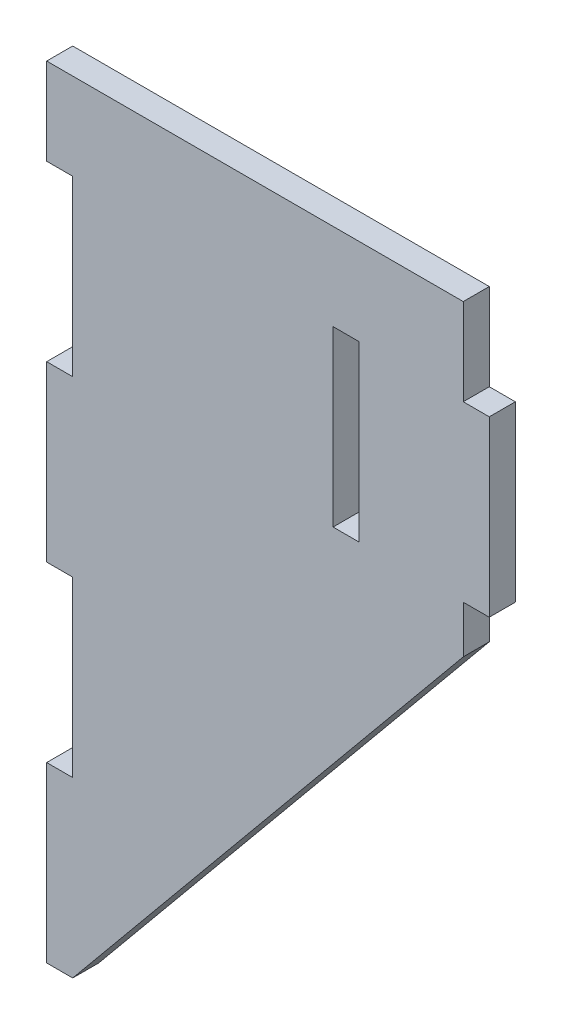
from build123d import *

# Parameters (mm, degrees)
SKETCH1_W           = 3
SKETCH1_H           = 20
BOSS_EXTRUDE1_DEPTH = 3


with BuildPart() as part:
    # Sketch1 → Boss-Extrude1 (new body)
    with BuildSketch(Plane.XY):
        Polygon((-3, 60), (-3, 40), (0, 40), (0, 20), (-3, 20), (-3, 0), (0, 0), (45, 54.545454545), (45, 60), (48, 60), (48, 80), (45, 80), (45, 90), (15, 90), (-3, 90), (-3, 80), (0, 80), (0, 60), align=None)
        with Locations((31.5, 70)):
            Rectangle(SKETCH1_W, SKETCH1_H, mode=Mode.SUBTRACT)
    extrude(amount=BOSS_EXTRUDE1_DEPTH)


solid = part.part
